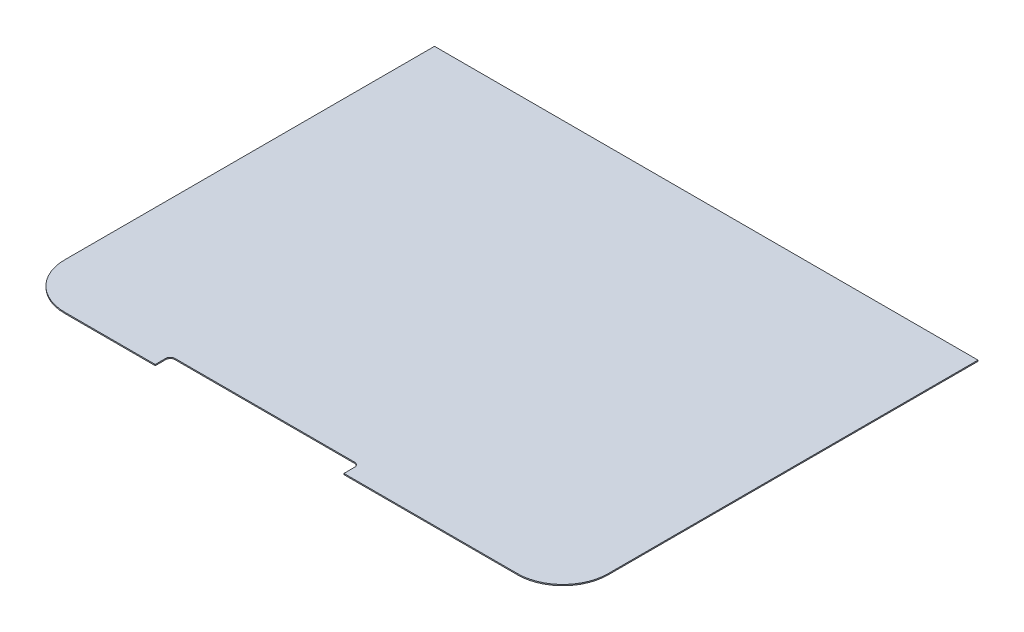
from build123d import *

# Parameters (mm, degrees)
SKETCH1_W          = 360
SKETCH1_H          = 315
BASE_FLANGE1_DEPTH = 0.75
FILLET1_R          = 30
SKETCH6_W          = 300
SKETCH6_H          = 40
CUT_EXTRUDE1_DEPTH = 10
CUT_EXTRUDE2_DEPTH = 10
BASE_FLANGE3_DEPTH = 300
CUT_EXTRUDE3_START = -10
CUT_EXTRUDE3_DEPTH = 10
CUT_EXTRUDE4_START = -10
CUT_EXTRUDE4_DEPTH = 10


# Sheet-metal steps are written as plain solids
with BuildPart() as part:
    # Sketch1 → Base-Flange1 (new body)
    with BuildSketch(Plane(origin=(0, 0, 0), x_dir=(1, 0, 0), z_dir=(0, 1, 0))):
        Rectangle(SKETCH1_W, SKETCH1_H)
    extrude(amount=-BASE_FLANGE1_DEPTH)

    # Fillet1
    fillet1_edges = [part.edges().sort_by_distance(p)[0] for p in [
        (-180, -0.375, -157.5),
        (180, -0.375, -157.5),
        (180, -0.375, 157.5),
        (-180, -0.375, 157.5),
    ]]
    fillet(fillet1_edges, radius=FILLET1_R)

    # Sketch6 → Cut-Extrude1 (cut)
    with BuildSketch(Plane(origin=(0, 0, 0), x_dir=(1, 0, 0), z_dir=(0, 1, 0))):
        with Locations((0, 137.5)):
            Rectangle(SKETCH6_W, SKETCH6_H)
    extrude(amount=-CUT_EXTRUDE1_DEPTH, mode=Mode.SUBTRACT)

    # Sketch7 → Cut-Extrude2 (cut)
    with BuildSketch(Plane(origin=(0, 0, 0), x_dir=(1, 0, 0), z_dir=(0, 1, 0))):
        with BuildLine():
            Line((-90, -157.5), (-90, -150.5))
            ThreePointArc((-90, -150.5), (-89.121320344, -148.378679656), (-87, -147.5))
            Line((-87, -147.5), (32, -147.5))
            ThreePointArc((32, -147.5), (34.121320344, -148.378679656), (35, -150.5))
            Line((35, -150.5), (35, -157.5))
            Line((35, -157.5), (-90, -157.5))
        make_face()
    extrude(amount=-CUT_EXTRUDE2_DEPTH, mode=Mode.SUBTRACT)

    # Sketch16 → Cut-Extrude3 (cut)
    with BuildSketch(Plane(origin=(0, 0, 0), x_dir=(1, 0, 0), z_dir=(0, 1, 0)).offset(CUT_EXTRUDE3_START)):
        with BuildLine():
            Line((-150, 157.5), (-150, 117.5))
            Line((-150, 117.5), (-180, 117.5))
            Line((-180, 117.5), (-180, 127.5))
            ThreePointArc((-180, 127.5), (-171.213203436, 148.713203436), (-150, 157.5))
        make_face()
    extrude(amount=CUT_EXTRUDE3_DEPTH, mode=Mode.SUBTRACT)

    # Sketch17 → Cut-Extrude4 (cut)
    with BuildSketch(Plane(origin=(0, 0, 0), x_dir=(1, 0, 0), z_dir=(0, 1, 0)).offset(CUT_EXTRUDE4_START)):
        with BuildLine():
            Line((150, 117.5), (150, 157.5))
            ThreePointArc((150, 157.5), (171.213203436, 148.713203436), (180, 127.5))
            Line((180, 127.5), (180, 117.5))
            Line((180, 117.5), (150, 117.5))
        make_face()
    extrude(amount=CUT_EXTRUDE4_DEPTH, mode=Mode.SUBTRACT)


with BuildPart() as body_2:
    # Sketch13 → Base-Flange3 (new body)
    with BuildSketch(Plane(origin=(-150, 0, 0), x_dir=(0, 0, -1), z_dir=(1, 0, 0))):
        with BuildLine():
            ThreePointArc((117.5, -0.75), (118.509330413, -3.95118709), (115.846409858, -1.907856282))
            Line((115.846409858, -1.907856282), (116.551179324, -2.16437139))
            ThreePointArc((116.551179324, -2.16437139), (118.079148085, -3.336823057), (117.5, -1.5))
            Line((117.5, -1.5), (117.5, -0.75))
        make_face()
    extrude(amount=BASE_FLANGE3_DEPTH)


solid = Compound([part.part, body_2.part])
